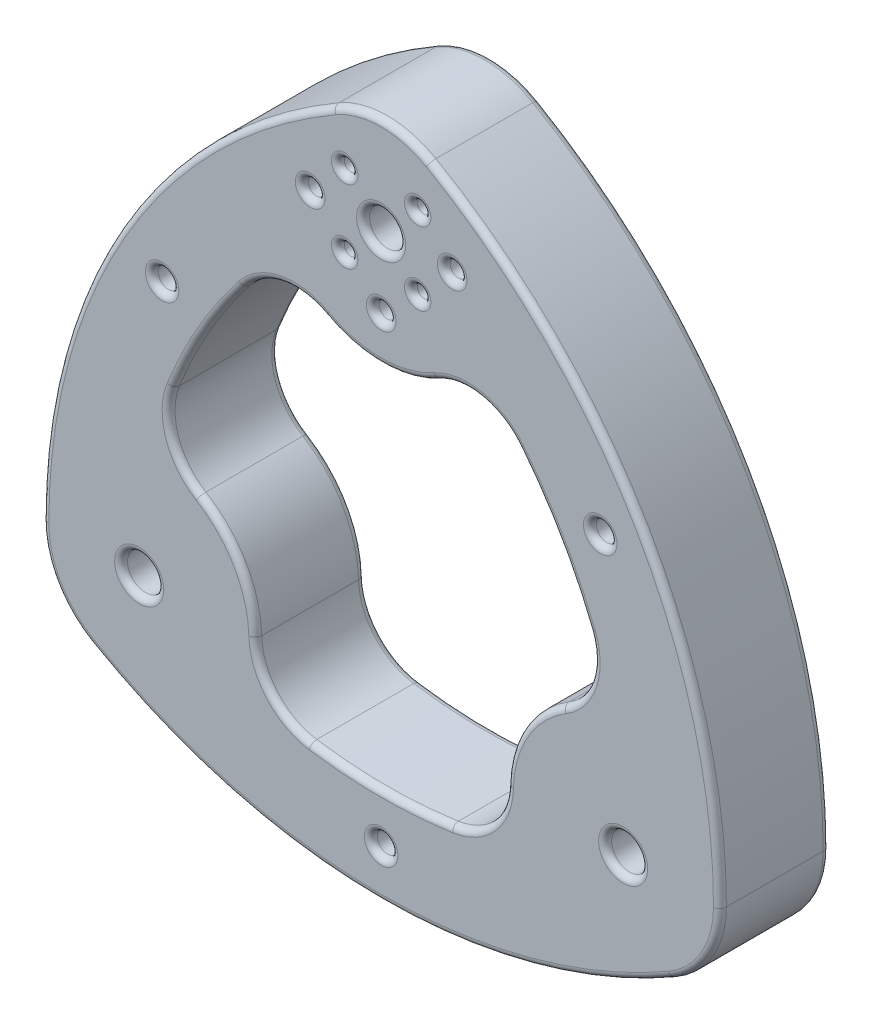
from build123d import *

# Parameters (mm, degrees)
BOSS_EXTRUDE1_DEPTH        = 17
CUT_EXTRUDE2_DEPTH         = 17
F_5_6_5_6_DIAMETER_HOLE1_D = 5.6
F_3_2_3_2_DIAMETER_HOLE1_D = 3.2
CIRPATTERN1_COUNT          = 3
CIRPATTERN2_COUNT          = 3
CUT_EXTRUDE3_REACH         = 82.276
SKETCH8_R                  = 1.05
SKETCH8_R_2                = 1.3
CIRPATTERN3_OUTLINE_R      = 1.3
CIRPATTERN3_DEPTH          = 17
CIRPATTERN5_OUTLINE_R      = 1.05
CIRPATTERN5_DEPTH          = 17
SKETCH9_R                  = 2
SKETCH9_R_2                = 2.5
CUT_EXTRUDE5_DEPTH         = 9
FILLET3_R                  = 10
FILLET2_R                  = 1


# Read off the part's stored shape, not the designer's step: CirPattern3, CirPattern5
with BuildPart() as part:
    # Sketch1 → Boss-Extrude1 (new body)
    with BuildSketch(Plane.XY):
        with BuildLine():
            ThreePointArc((-7.5, 56.291651246), (-40.442286341, 23.349364905), (-52.5, -21.650635095))
            ThreePointArc((-52.5, -21.650635095), (-50.490381057, -29.150635095), (-45, -34.641016151))
            ThreePointArc((-45, -34.641016151), (0, -46.698729811), (45, -34.641016151))
            ThreePointArc((45, -34.641016151), (50.490381057, -29.150635095), (52.5, -21.650635095))
            ThreePointArc((52.5, -21.650635095), (40.442286341, 23.349364905), (7.5, 56.291651246))
            ThreePointArc((7.5, 56.291651246), (0, 58.301270189), (-7.5, 56.291651246))
        make_face()
    extrude(amount=BOSS_EXTRUDE1_DEPTH)

    # Sketch3 → Cut-Extrude2 (cut)
    with BuildSketch(Plane.XY):
        with BuildLine():
            ThreePointArc((14.395813387, 32.495690292), (0, 25.301270189), (-14.395813387, 32.495690292))
            ThreePointArc((-14.395813387, 32.495690292), (-27.451905284, 15.849364905), (-35.34, -3.780705044))
            ThreePointArc((-35.34, -3.780705044), (-21.911542732, -12.650635095), (-20.944186613, -28.714985248))
            ThreePointArc((-20.944186613, -28.714985248), (0, -31.698729811), (20.944186613, -28.714985248))
            ThreePointArc((20.944186613, -28.714985248), (21.911542732, -12.650635095), (35.34, -3.780705044))
            ThreePointArc((35.34, -3.780705044), (27.451905284, 15.849364905), (14.395813387, 32.495690292))
        make_face()
    extrude(amount=CUT_EXTRUDE2_DEPTH, mode=Mode.SUBTRACT)

    # Ø5.6 (5.6) Diameter Hole1 (through all)
    with Locations(Plane(origin=(0, 0, 0), x_dir=(-1, 0, 0), z_dir=(0, 0, -1))):
        with Locations((-37.498899984, -21.65)):
            f_5_6_5_6_diameter_hole1 = Hole(F_5_6_5_6_DIAMETER_HOLE1_D / 2)

    # Ø3.2 (3.2) Diameter Hole1 (through all)
    with Locations(Plane(origin=(0, 0, 0), x_dir=(-1, 0, 0), z_dir=(0, 0, -1))):
        with Locations((0, -39.198729811)):
            f_3_2_3_2_diameter_hole1 = Hole(F_3_2_3_2_DIAMETER_HOLE1_D / 2)

    # CirPattern1: Ø3.2 (3.2) Diameter Hole1 ×3 about axis
    cirpattern1_axis = Axis((0, 0, 0), (0, 0, 1))
    for i in range(1, CIRPATTERN1_COUNT):
        add(f_3_2_3_2_diameter_hole1.rotate(cirpattern1_axis, i * 360 / CIRPATTERN1_COUNT), mode=Mode.SUBTRACT)

    # CirPattern2: Ø5.6 (5.6) Diameter Hole1 ×3 about axis
    cirpattern2_axis = Axis((0, 0, 0), (0, 0, 1))
    for i in range(1, CIRPATTERN2_COUNT):
        add(f_5_6_5_6_diameter_hole1.rotate(cirpattern2_axis, i * 360 / CIRPATTERN2_COUNT), mode=Mode.SUBTRACT)

    # Sketch8 → Cut-Extrude3 (cut, up to next)
    with BuildSketch(Plane(origin=(0, 0, 0), x_dir=(-1, 0, 0), z_dir=(0, 0, -1)), mode=Mode.PRIVATE) as cut_extrude3_sk1:
        with Locations((5.656854249, 48.956854249)):
            Circle(SKETCH8_R)
    cut_extrude3_tool1 = extrude(cut_extrude3_sk1.sketch, amount=-CUT_EXTRUDE3_REACH, mode=Mode.PRIVATE) & part.part
    # Sketch8 → Cut-Extrude3 (cut, up to next)
    with BuildSketch(Plane(origin=(0, 0, 0), x_dir=(-1, 0, 0), z_dir=(0, 0, -1)), mode=Mode.PRIVATE) as cut_extrude3_sk2:
        with Locations((-11, 43.3)):
            Circle(SKETCH8_R_2)
    cut_extrude3_tool2 = extrude(cut_extrude3_sk2.sketch, amount=-CUT_EXTRUDE3_REACH, mode=Mode.PRIVATE) & part.part
    add(cut_extrude3_tool1.solids().sort_by_distance((-5.656854, 48.956854, 0))[0], mode=Mode.SUBTRACT)
    add(cut_extrude3_tool2.solids().sort_by_distance((11, 43.3, 0))[0], mode=Mode.SUBTRACT)

    # CirPattern3 outline → CirPattern3 (cut)
    with BuildSketch(Plane.XY):
        with Locations((0, 32.3)):
            Circle(CIRPATTERN3_OUTLINE_R)
        with Locations((-11, 43.3)):
            Circle(CIRPATTERN3_OUTLINE_R)
    extrude(amount=CIRPATTERN3_DEPTH, mode=Mode.SUBTRACT)

    # CirPattern5 outline → CirPattern5 (cut)
    with BuildSketch(Plane.XY):
        with Locations((5.656854249, 48.956854249)):
            Circle(CIRPATTERN5_OUTLINE_R)
        with Locations((5.656854249, 37.643145751)):
            Circle(CIRPATTERN5_OUTLINE_R)
        with Locations((-5.656854249, 37.643145751)):
            Circle(CIRPATTERN5_OUTLINE_R)
    extrude(amount=CIRPATTERN5_DEPTH, mode=Mode.SUBTRACT)

    # Sketch9 → Cut-Extrude5 (cut)
    with BuildSketch(Plane(origin=(0, 0, 0), x_dir=(-1, 0, 0), z_dir=(0, 0, -1))):
        with Locations((-5.656854249, 37.643145751)):
            Circle(SKETCH9_R)
        with Locations((-5.656854249, 48.956854249)):
            Circle(SKETCH9_R)
        with Locations((5.656854249, 48.956854249)):
            Circle(SKETCH9_R)
        with Locations((5.656854249, 37.643145751)):
            Circle(SKETCH9_R)
        with Locations((0, 32.3)):
            Circle(SKETCH9_R_2)
        with Locations((-11, 43.3)):
            Circle(SKETCH9_R_2)
        with Locations((11, 43.3)):
            Circle(SKETCH9_R_2)
    extrude(amount=-CUT_EXTRUDE5_DEPTH, mode=Mode.SUBTRACT)

    # Fillet3
    fillet3_edges = [part.edges().sort_by_distance(p)[0] for p in [
        (35.34, -3.780705044, 8.5),
        (14.395813387, 32.495690292, 8.5),
        (-14.395813387, 32.495690292, 8.5),
        (-35.34, -3.780705044, 8.5),
        (-20.944186613, -28.714985248, 8.5),
        (20.944186613, -28.714985248, 8.5),
    ]]
    fillet(fillet3_edges, radius=FILLET3_R)

    # Fillet2
    fillet2_edges = [part.edges().sort_by_distance(p)[0] for p in [
        (-50.490381057, -29.150635095, 17),
        (-3.656854249, 48.956854249, 0),
        (-3.656854249, 37.643145751, 0),
        (2.5, 32.3, 0),
        (13.5, 43.3, 0),
        (-8.5, 43.3, 0),
        (7.656854249, 37.643145751, 0),
        (0, -46.698729811, 17),
        (21.911542732, -12.650635095, 17),
        (21.911542732, -12.650635095, 0),
        (27.451905284, 15.849364905, 17),
        (27.451905284, 15.849364905, 0),
        (0, -31.698729811, 17),
        (0, -31.698729811, 0),
        (-21.911542732, -12.650635095, 17),
        (-21.911542732, -12.650635095, 0),
        (-27.451905284, 15.849364905, 17),
        (-27.451905284, 15.849364905, 0),
        (0, 25.301270189, 17),
        (0, 25.301270189, 0),
        (32.421058039, -0.913529851, 0),
        (32.421058039, -0.913529851, 17),
        (17.001669077, -27.620694954, 0),
        (17.001669077, -27.620694954, 17),
        (-17.001669077, -27.620694954, 0),
        (-17.001669077, -27.620694954, 17),
        (-32.421058039, -0.913529851, 0),
        (-32.421058039, -0.913529851, 17),
        (-15.419388962, 28.534224805, 0),
        (-15.419388962, 28.534224805, 17),
        (15.419388962, 28.534224805, 0),
        (15.419388962, 28.534224805, 17),
        (50.490381057, -29.150635095, 17),
        (40.442286341, 23.349364905, 17),
        (0, 58.301270189, 17),
        (34.698899984, -21.65, 0),
        (34.698899984, -21.65, 17),
        (-1.6, -39.198729811, 0),
        (-1.6, -39.198729811, 17),
        (34.747095812, 18.213724259, 0),
        (34.747095812, 18.213724259, 17),
        (-33.147095812, 20.985005552, 0),
        (-33.147095812, 20.985005552, 17),
        (40.442286341, 23.349364905, 0),
        (1.4, 40.87512887, 0),
        (1.4, 40.87512887, 17),
        (50.490381057, -29.150635095, 0),
        (-36.098899984, -19.22512887, 0),
        (-36.098899984, -19.22512887, 17),
        (0, -46.698729811, 0),
        (-40.442286341, 23.349364905, 17),
        (-50.490381057, -29.150635095, 0),
        (-4.606854249, 48.956854249, 17),
        (12.3, 43.3, 17),
        (-40.442286341, 23.349364905, 0),
        (-12.3, 43.3, 17),
        (0, 58.301270189, 0),
        (-1.3, 32.3, 17),
        (-6.706854249, 37.643145751, 17),
        (4.606854249, 37.643145751, 17),
        (4.606854249, 48.956854249, 17),
        (7.656854249, 48.956854249, 0),
    ]]
    fillet(fillet2_edges, radius=FILLET2_R)


solid = part.part
